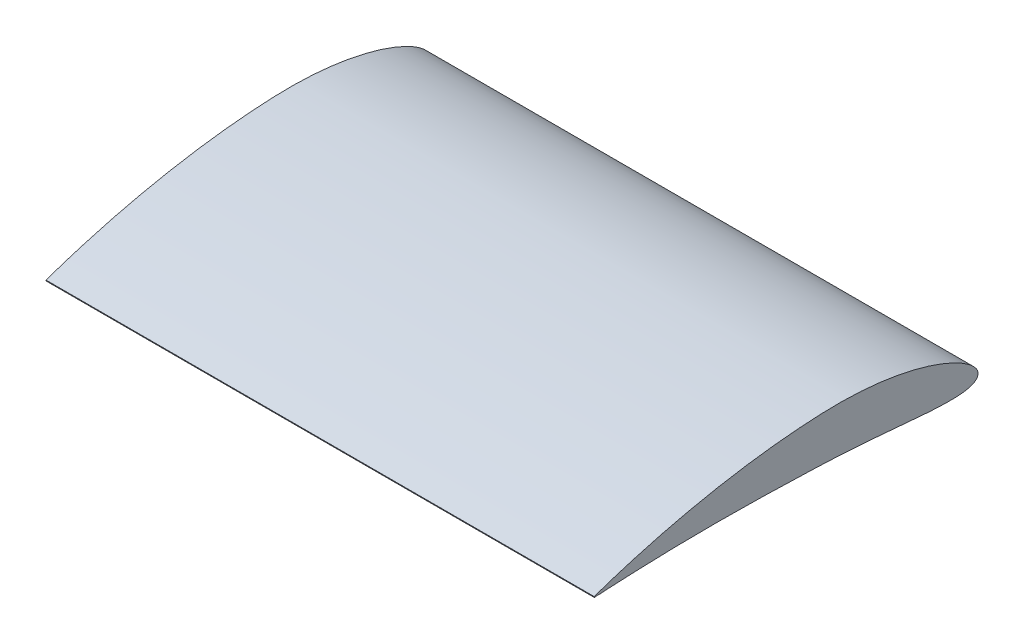
from build123d import *

# Parameters (mm, degrees)
BOSS_EXTRUDE1_DEPTH      = 254
BOSS_EXTRUDE1_DEPTH_BACK = 254


with BuildPart() as part:
    # Sketch1 → Boss-Extrude1 (new, two sides: drawn at the far end of the back side and taken through both)
    with BuildSketch(Plane(origin=(0, 0, 0), x_dir=(0, 0, -1), z_dir=(1, 0, 0)).offset(-BOSS_EXTRUDE1_DEPTH_BACK)):
        with BuildLine():
            Line((-354.787327228, -0.030257196), (-354.876173011, 0.410417887))
            add(Edge.make_bspline(
                [(-354.876173011, 0.410417887), (-354.559877309, 0.519388), (-353.29965963, 0.95355787), (-350.47872665, 1.927095868), (-345.800950265, 3.497798274), (-336.024074692, 6.721551148), (-319.654473712, 11.798891927), (-300.598349456, 17.130600639), (-282.422876264, 21.724272526), (-261.175777938, 26.651569731), (-238.622276389, 31.145528798), (-208.774809213, 36.004755717), (-183.96165787, 39.090454058), (-158.902335219, 41.113212891), (-140.096691022, 42.111376668), (-121.516747473, 42.228858195), (-103.422167262, 41.321050632), (-86.188408528, 39.478676181), (-70.043450957, 36.810480574), (-55.199760436, 33.432905997), (-41.843390777, 29.510854383), (-30.130463623, 25.220125297), (-20.187014188, 20.73431935), (-12.107203154, 16.226289935), (-5.926897661, 11.855341958), (-1.679224073, 7.716499794), (0.765838065, 3.796757813), (0.987487677, -0.148325216), (-1.35108726, -3.308943186), (-5.450780885, -5.288085739), (-11.087315968, -6.587464624), (-18.34911979, -7.268527656), (-27.163826626, -7.404874951), (-37.447057223, -7.053797092), (-49.083078017, -6.301866785), (-61.95239395, -5.238034817), (-75.929862643, -3.983911698), (-96.406736552, -2.153555858), (-117.937239158, -0.458414508), (-140.484776897, 0.674535203), (-158.296467959, 1.286744043), (-176.48388462, 1.917893193), (-200.671973719, 2.586246563), (-224.541124114, 2.979106232), (-247.830237405, 3.028480659), (-264.337268621, 2.907447598), (-279.933149694, 2.656365926), (-294.437996632, 2.282890374), (-307.681856469, 1.852126627), (-319.513378006, 1.371074809), (-329.767358246, 0.912902227), (-338.388880463, 0.426846955), (-345.076973543, 0.191518705), (-350.227621538, -0.406394891), (-352.780150329, -0.035387827), (-354.744619464, -0.75811662), (-354.777220059, -0.20251155), (-354.787327228, -0.030257196)],
                knots=[0, 0, 0, 0, 0.001371577, 0.005464776, 0.012234802, 0.021601969, 0.04767125, 0.082496261, 0.102719149, 0.124527079, 0.171912573, 0.19697838, 0.248496767, 0.274385101, 0.300041178, 0.325689988, 0.350525088, 0.374279703, 0.396711254, 0.417576734, 0.436654006, 0.45374439, 0.468679994, 0.481329415, 0.491630702, 0.499615789, 0.505546281, 0.510184984, 0.514824194, 0.520701508, 0.52851604, 0.538465752, 0.550542609, 0.564643256, 0.580638139, 0.598344876, 0.617584458, 0.638174401, 0.682632113, 0.706120665, 0.730727383, 0.755700244, 0.780731769, 0.829932396, 0.853570292, 0.876213105, 0.897609987, 0.917519394, 0.935698347, 0.951942678, 0.966047159, 0.97783994, 0.987174002, 0.993931501, 0.998018399, 0.999385644, 1, 1, 1, 1], degree=3))
        make_face()
    extrude(amount=BOSS_EXTRUDE1_DEPTH + BOSS_EXTRUDE1_DEPTH_BACK)


solid = part.part
